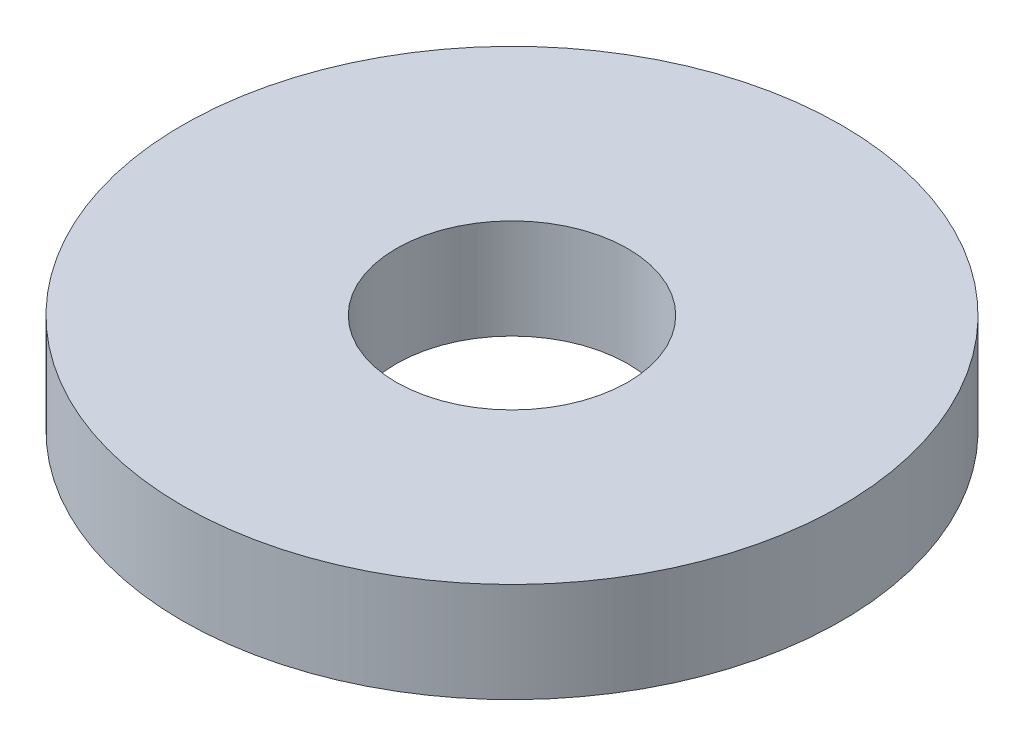
from build123d import *

# Parameters (mm, degrees)
SKETCH1_R           = 92.5
BOSS_EXTRUDE1_DEPTH = 28
SKETCH2_R           = 32.5
CUT_EXTRUDE1_DEPTH  = 134.777800849


with BuildPart() as part:
    # Sketch1 → Boss-Extrude1 (new body)
    with BuildSketch(Plane(origin=(0, 0, 0), x_dir=(1, 0, 0), z_dir=(0, 1, 0))):
        Circle(SKETCH1_R)
    extrude(amount=BOSS_EXTRUDE1_DEPTH)

    # Sketch2 → Cut-Extrude1 (cut, through all)
    with BuildSketch(Plane(origin=(0, 0, 0), x_dir=(1, 0, 0), z_dir=(0, 1, 0))):
        Circle(SKETCH2_R)
    extrude(amount=CUT_EXTRUDE1_DEPTH, mode=Mode.SUBTRACT)


solid = part.part
